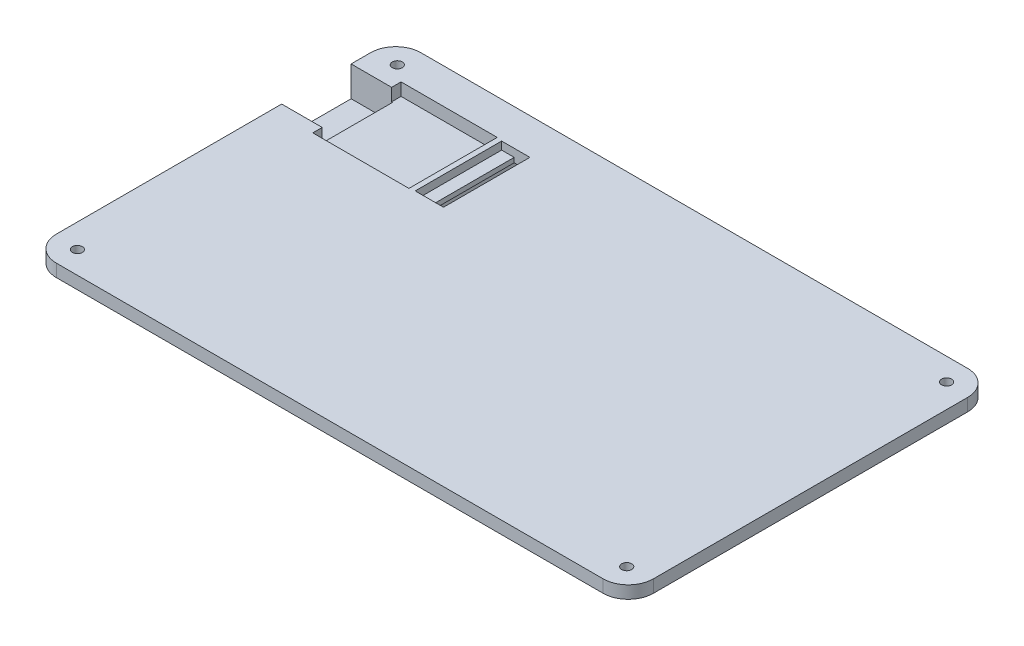
from build123d import *

# Parameters (mm, degrees)
SKETCH_1_W          = 272.533053494
SKETCH_1_H          = 136.587531522
EXTRUDE_1_DEPTH     = 4
SKETCH_2_W          = 272.533053494
SKETCH_2_H          = 136.587531522
CUT_EXTRUDE_1_DEPTH = 4
CUT_EXTRUDE_2_DEPTH = 4
CUT_EXTRUDE_3_DEPTH = 4
SKETCH_5_W          = 34
SKETCH_5_H          = 36
EXTRUDE_2_DEPTH     = 4
SKETCH_6_W          = 13.2
SKETCH_6_H          = 4
EXTRUDE_3_DEPTH     = 5.6
SKETCH_7_W          = 17.2
SKETCH_7_H          = 30.1
EXTRUDE_4_DEPTH     = 4
SKETCH_8_W          = 5
SKETCH_8_H          = 27.5
CUT_EXTRUDE_4_DEPTH = 4
SKETCH_9_W          = 27.5
SKETCH_9_H          = 2.5
CUT_EXTRUDE_5_DEPTH = 4
SKETCH_10_R         = 1.6
CUT_EXTRUDE_6_DEPTH = 10


with BuildPart() as part:
    # 草图1 → 凸台-拉伸1 (new body)
    with BuildSketch(Plane(origin=(0, 0, 0), x_dir=(1, 0, 0), z_dir=(0, 1, 0))):
        Rectangle(SKETCH_1_W, SKETCH_1_H)
    extrude(amount=EXTRUDE_1_DEPTH)

    # 草图2 → 切除-拉伸1 (cut)
    with BuildSketch(Plane(origin=(0, 4, 0), x_dir=(1, 0, 0), z_dir=(0, 1, 0))):
        Rectangle(SKETCH_2_W, SKETCH_2_H)
        with BuildLine():
            Line((-87, 58), (87, 58))
            ThreePointArc((87, 58), (92.656854249, 55.656854249), (95, 50))
            Line((95, 50), (95, -50))
            ThreePointArc((95, -50), (92.656854249, -55.656854249), (87, -58))
            Line((87, -58), (-87, -58))
            ThreePointArc((-87, -58), (-92.656854249, -55.656854249), (-95, -50))
            Line((-95, -50), (-95, 50))
            ThreePointArc((-95, 50), (-92.656854249, 55.656854249), (-87, 58))
        make_face(mode=Mode.SUBTRACT)
    extrude(amount=-CUT_EXTRUDE_1_DEPTH, mode=Mode.SUBTRACT)

    # 草图3 → 切除-拉伸2 (cut)
    with BuildSketch(Plane.XZ):
        Polygon((-95, -22), (-81.8, -22), (-81.8, -19), (-51.8, -19), (-51.8, -46.5), (-81.8, -46.5), (-81.8, -43.5), (-95, -43.5), align=None)
    extrude(amount=-CUT_EXTRUDE_2_DEPTH, mode=Mode.SUBTRACT)

    # 草图4 → 切除-拉伸3 (cut)
    with BuildSketch(Plane.XZ):
        Polygon((-51.5, -18.7), (-51.5, -46.8), (-82.1, -46.8), (-82.1, -43.8), (-95, -43.8), (-95, -21.7), (-82.1, -21.7), (-82.1, -18.7), align=None)
    extrude(amount=-CUT_EXTRUDE_3_DEPTH, mode=Mode.SUBTRACT)

    # 草图5 → 凸台-拉伸2 (add)
    with BuildSketch(Plane.XZ):
        with Locations((-64.8, -32.75)):
            Rectangle(SKETCH_5_W, SKETCH_5_H)
    extrude(amount=EXTRUDE_2_DEPTH)

    # 草图6 → 凸台-拉伸3 (add)
    with BuildSketch(Plane.XZ):
        with Locations((-88.4, -19.7)):
            Rectangle(SKETCH_6_W, SKETCH_6_H)
        with Locations((-88.4, -45.8)):
            Rectangle(SKETCH_6_W, SKETCH_6_H)
    extrude(amount=EXTRUDE_3_DEPTH)

    # 草图7 → 凸台-拉伸4 (add)
    with BuildSketch(Plane.XZ.offset(5.6)):
        with Locations((-86.4, -32.75)):
            Rectangle(SKETCH_7_W, SKETCH_7_H)
    extrude(amount=EXTRUDE_4_DEPTH)

    # 草图8 → 切除-拉伸4 (cut)
    with BuildSketch(Plane(origin=(0, 4, 0), x_dir=(1, 0, 0), z_dir=(0, 1, 0))):
        with Locations((-43.3, 32.75)):
            Rectangle(SKETCH_8_W, SKETCH_8_H)
    extrude(amount=-CUT_EXTRUDE_4_DEPTH, mode=Mode.SUBTRACT)

    # 草图9 → 切除-拉伸5 (cut)
    with BuildSketch(Plane(origin=(-45.8, 0, 0), x_dir=(0, 0, -1), z_dir=(1, 0, 0))):
        with Locations((32.75, 2.75)):
            Rectangle(SKETCH_9_W, SKETCH_9_H)
    extrude(amount=-CUT_EXTRUDE_5_DEPTH, mode=Mode.SUBTRACT)

    # 草图10 → 切除-拉伸6 (cut)
    with BuildSketch(Plane(origin=(0, 4, 0), x_dir=(1, 0, 0), z_dir=(0, 1, 0))):
        with Locations((87.4, 50.9)):
            Circle(SKETCH_10_R)
        with Locations((-87.4, 50.9)):
            Circle(SKETCH_10_R)
        with Locations((-87.4, -50.9)):
            Circle(SKETCH_10_R)
        with Locations((87.4, -50.9)):
            Circle(SKETCH_10_R)
    extrude(amount=-CUT_EXTRUDE_6_DEPTH, mode=Mode.SUBTRACT)


solid = part.part
